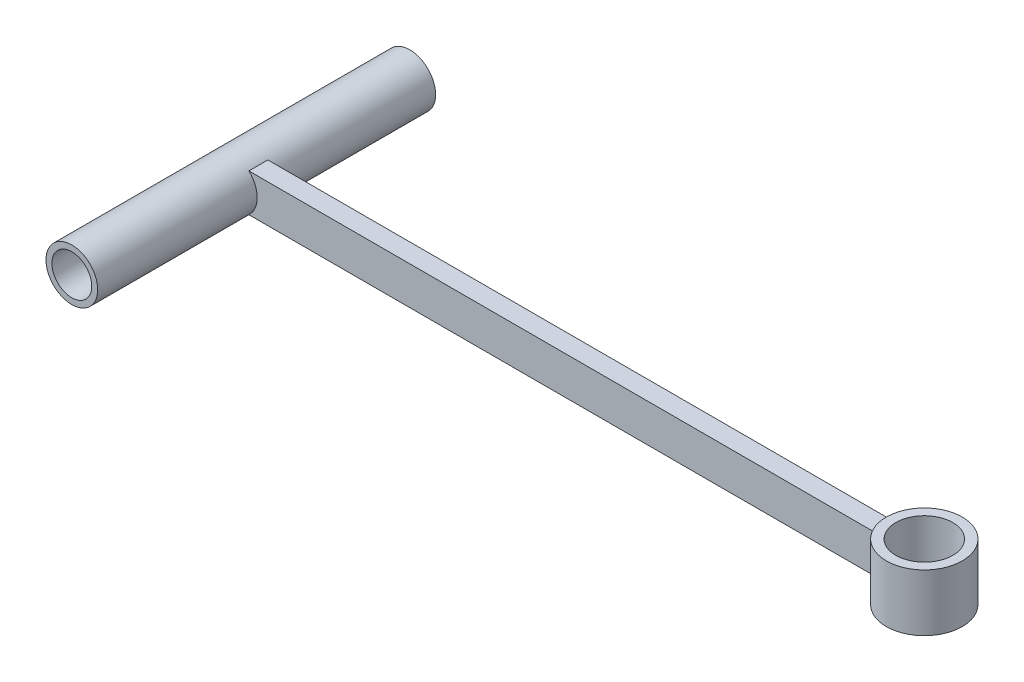
from build123d import *

# Parameters (mm, degrees)
SKETCH1_R             = 34.6075
SKETCH1_R_2           = 26.67
BOSS_EXTRUDE1_DEPTH   = 226.06
BOSS_EXTRUDE2_START   = -12.7
BOSS_EXTRUDE2_DEPTH   = 3.175
BOSS_EXTRUDE2_START_2 = 9.525
BOSS_EXTRUDE2_2_DEPTH = 3.175
BOSS_EXTRUDE2_START_3 = -9.525
BOSS_EXTRUDE2_3_DEPTH = 19.05
SKETCH3_R             = 50.8
SKETCH3_R_2           = 38.1
BOSS_EXTRUDE3_DEPTH   = 38.1


# Read off the part's stored shape, not the designer's step: Boss-Extrude2
with BuildPart() as part:
    # Sketch1 → Boss-Extrude1 (new, symmetric)
    with BuildSketch(Plane.XY):
        with Locations(Location((0, 0, 0), (0, 0, 180))):
            Circle(SKETCH1_R)
        with Locations(Location((0, 0, 0), (0, 0, 180))):
            Circle(SKETCH1_R_2, mode=Mode.SUBTRACT)
    extrude(amount=BOSS_EXTRUDE1_DEPTH, both=True)

    # Boss-Extrude2 outline → Boss-Extrude2 (add)
    with BuildSketch(Plane.XY.offset(BOSS_EXTRUDE2_START)):
        with BuildLine():
            Line((861.705723904, 25.4), (23.505723904, 25.4))
            ThreePointArc((23.505723904, 25.4), (34.6075, 0), (23.505723904, -25.4))
            Line((23.505723904, -25.4), (861.705723904, -25.4))
            ThreePointArc((861.705723904, -25.4), (872.8075, 0), (861.705723904, 25.4))
        make_face()
    extrude(amount=BOSS_EXTRUDE2_DEPTH)

    # Boss-Extrude2 2 outline → Boss-Extrude2 2 (add)
    with BuildSketch(Plane.XY.offset(BOSS_EXTRUDE2_START_2)):
        with BuildLine():
            Line((861.705723904, 25.4), (23.505723904, 25.4))
            ThreePointArc((23.505723904, 25.4), (34.6075, 0), (23.505723904, -25.4))
            Line((23.505723904, -25.4), (861.705723904, -25.4))
            ThreePointArc((861.705723904, -25.4), (872.8075, 0), (861.705723904, 25.4))
        make_face()
    extrude(amount=BOSS_EXTRUDE2_2_DEPTH)

    # Boss-Extrude2 3 outline → Boss-Extrude2 3 (add)
    with BuildSketch(Plane.XY.offset(BOSS_EXTRUDE2_START_3)):
        with BuildLine():
            ThreePointArc((864.727880263, 22.225), (863.267120751, 23.86039634), (861.705723904, 25.4))
            Line((861.705723904, 25.4), (23.505723904, 25.4))
            ThreePointArc((23.505723904, 25.4), (25.067120751, 23.86039634), (26.527880263, 22.225))
            Line((26.527880263, 22.225), (864.727880263, 22.225))
        make_face()
        with BuildLine():
            ThreePointArc((861.705723904, -25.4), (863.267120751, -23.86039634), (864.727880263, -22.225))
            Line((864.727880263, -22.225), (26.527880263, -22.225))
            ThreePointArc((26.527880263, -22.225), (25.067120751, -23.86039634), (23.505723904, -25.4))
            Line((23.505723904, -25.4), (861.705723904, -25.4))
        make_face()
    extrude(amount=BOSS_EXTRUDE2_3_DEPTH)

    # Sketch3 → Boss-Extrude3 (add, symmetric)
    with BuildSketch(Plane(origin=(0, 0, 0), x_dir=(1, 0, 0), z_dir=(0, 1, 0))):
        with Locations(Location((914.4, 0, 0), (0, 0, 270))):
            Circle(SKETCH3_R)
        with Locations(Location((914.4, 0, 0), (0, 0, 90))):
            Circle(SKETCH3_R_2, mode=Mode.SUBTRACT)
    extrude(amount=BOSS_EXTRUDE3_DEPTH, both=True)


solid = part.part
